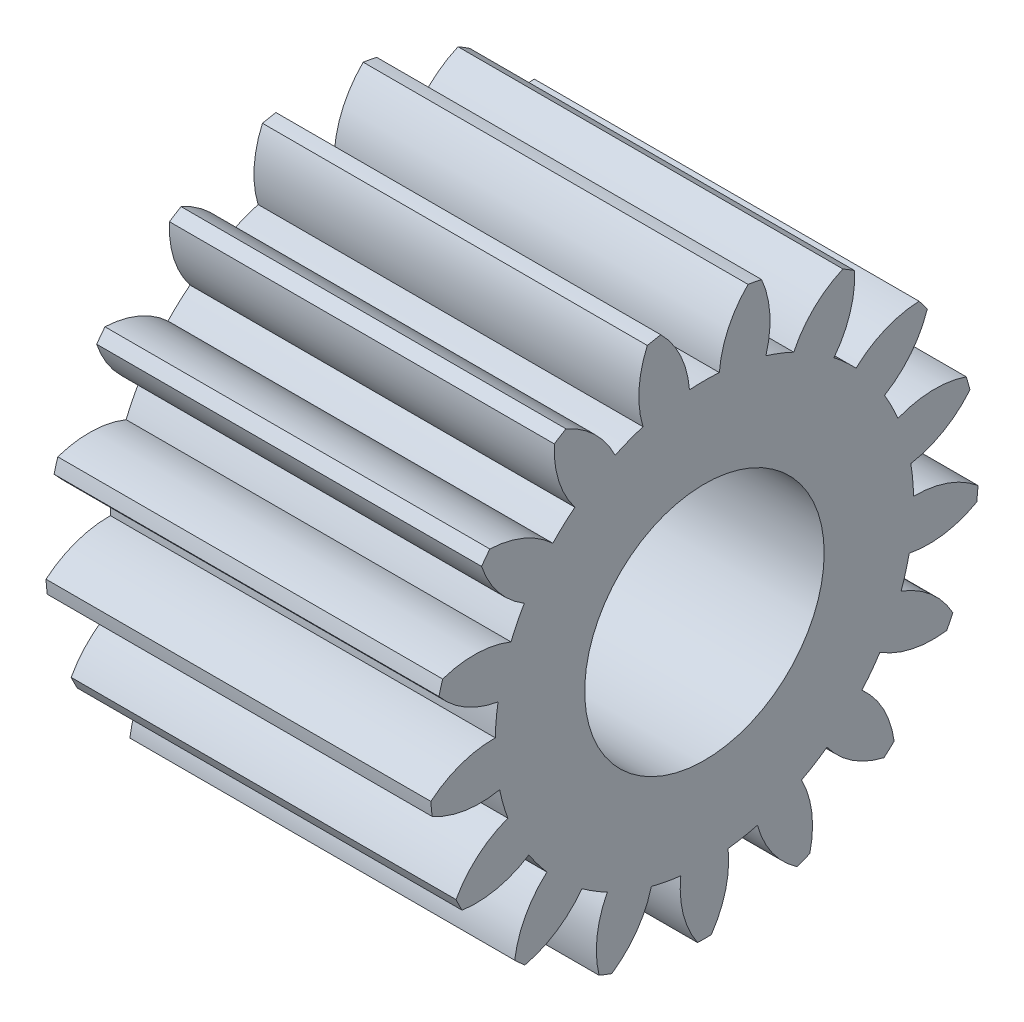
from build123d import *

# Parameters (mm, degrees)
SPUR_START             = -65.99548243
SPUR_GEAR_AM_OUTLINE_R = 2
SPUR_GEAR_AM_DEPTH     = 8.001
SKETCH1_R              = 2.4892
CUT_EXTRUDE1_DEPTH     = 38.916221237


# Read off the part's stored shape, not the designer's step: spur gear_am
with BuildPart() as part:
    # spur gear_am outline → spur gear_am (new body)
    with BuildSketch(Plane.YZ.offset(SPUR_START)):
        with BuildLine():
            ThreePointArc((15.314879055, 24.539540588), (15.391528072, 24.659938624), (15.465138567, 24.782218033))
            ThreePointArc((15.465138567, 24.782218033), (15.063480167, 25.38187856), (14.478147109, 25.804143203))
            ThreePointArc((14.478147109, 25.804143203), (14.600612124, 26.089561946), (14.70239475, 26.38299309))
            ThreePointArc((14.70239475, 26.38299309), (15.41943895, 26.300714095), (16.120256774, 26.473273058))
            ThreePointArc((16.120256774, 26.473273058), (16.148237066, 26.613229702), (16.172704392, 26.753843033))
            ThreePointArc((16.172704392, 26.753843033), (15.58154672, 27.167914071), (14.883200315, 27.350217435))
            ThreePointArc((14.883200315, 27.350217435), (14.894290398, 27.660601953), (14.883200315, 27.970986471))
            ThreePointArc((14.883200315, 27.970986471), (15.58154672, 28.153289835), (16.172704392, 28.567360874))
            ThreePointArc((16.172704392, 28.567360874), (16.148237066, 28.707974205), (16.120256774, 28.847930848))
            ThreePointArc((16.120256774, 28.847930848), (15.41943895, 29.020489811), (14.70239475, 28.938210816))
            ThreePointArc((14.70239475, 28.938210816), (14.600612124, 29.23164196), (14.478147109, 29.517060703))
            ThreePointArc((14.478147109, 29.517060703), (15.063480167, 29.939325346), (15.465138567, 30.538985873))
            ThreePointArc((15.465138567, 30.538985873), (15.391528072, 30.661265282), (15.314879055, 30.781663318))
            ThreePointArc((15.314879055, 30.781663318), (14.599050409, 30.68940516), (13.960149206, 30.35365604))
            ThreePointArc((13.960149206, 30.35365604), (13.759240179, 30.590504307), (13.541939811, 30.812409893))
            ThreePointArc((13.541939811, 30.812409893), (13.93520705, 31.417606636), (14.093119986, 32.121869174))
            ThreePointArc((14.093119986, 32.121869174), (13.980307826, 32.209300149), (13.865341959, 32.293879155))
            ThreePointArc((13.865341959, 32.293879155), (13.231179117, 31.949263852), (12.756708059, 31.405389388))
            ThreePointArc((12.756708059, 31.405389388), (12.483806507, 31.553667107), (12.201018405, 31.682089957))
            ThreePointArc((12.201018405, 31.682089957), (12.349106905, 32.388483625), (12.241947359, 33.102233616))
            ThreePointArc((12.241947359, 33.102233616), (12.105169441, 33.143008119), (11.967413502, 33.180345233))
            ThreePointArc((11.967413502, 33.180345233), (11.500563669, 32.629914991), (11.254602702, 31.951368441))
            ThreePointArc((11.254602702, 31.951368441), (10.946565493, 31.991049886), (10.636481757, 32.008645782))
            ThreePointArc((10.636481757, 32.008645782), (10.519391345, 32.720833997), (10.161631808, 33.347675549))
            ThreePointArc((10.161631808, 33.347675549), (10.019360749, 33.336286758), (9.87741944, 33.321339395))
            ThreePointArc((9.87741944, 33.321339395), (9.640933273, 32.639432869), (9.656700788, 31.917855705))
            ThreePointArc((9.656700788, 31.917855705), (9.355130054, 31.843581675), (9.059629211, 31.747974194))
            ThreePointArc((9.059629211, 31.747974194), (8.693173595, 32.369771991), (8.133131476, 32.82504668))
            ThreePointArc((8.133131476, 32.82504668), (8.00458177, 32.763032714), (7.877625051, 32.697819598))
            ThreePointArc((7.877625051, 32.697819598), (7.903441318, 31.976532042), (8.178807825, 31.309377259))
            ThreePointArc((8.178807825, 31.309377259), (7.924432364, 31.131178875), (7.68342344, 30.935280336))
            ThreePointArc((7.68342344, 30.935280336), (7.117094483, 31.382710477), (6.430406572, 31.604930933))
            ThreePointArc((6.430406572, 31.604930933), (6.33293957, 31.500667122), (6.23811365, 31.393995646))
            ThreePointArc((6.23811365, 31.393995646), (6.52274572, 30.730740941), (7.020521446, 30.208111489))
            ThreePointArc((7.020521446, 30.208111489), (6.847696075, 29.950055429), (6.69372866, 29.680323017))
            ThreePointArc((6.69372866, 29.680323017), (6.004012226, 29.892957582), (5.283419531, 29.852111701))
            ThreePointArc((5.283419531, 29.852111701), (5.23019869, 29.71967945), (5.180310335, 29.585956188))
            ThreePointArc((5.180310335, 29.585956188), (5.685317071, 29.070310558), (6.338274646, 28.76279044))
            ThreePointArc((6.338274646, 28.76279044), (6.270340387, 28.459728606), (6.224208635, 28.152591177))
            ThreePointArc((6.224208635, 28.152591177), (5.504254749, 28.10171269), (4.847077307, 27.803316934))
            ThreePointArc((4.847077307, 27.803316934), (4.845290398, 27.660601953), (4.847077307, 27.517886972))
            ThreePointArc((4.847077307, 27.517886972), (5.504254749, 27.219491216), (6.224208635, 27.168612729))
            ThreePointArc((6.224208635, 27.168612729), (6.270340387, 26.8614753), (6.338274646, 26.558413466))
            ThreePointArc((6.338274646, 26.558413466), (5.685317071, 26.250893348), (5.180310335, 25.735247718))
            ThreePointArc((5.180310335, 25.735247718), (5.23019869, 25.601524456), (5.283419531, 25.469092205))
            ThreePointArc((5.283419531, 25.469092205), (6.004012226, 25.428246324), (6.69372866, 25.640880889))
            ThreePointArc((6.69372866, 25.640880889), (6.847696075, 25.371148477), (7.020521446, 25.113092417))
            ThreePointArc((7.020521446, 25.113092417), (6.52274572, 24.590462965), (6.23811365, 23.927208261))
            ThreePointArc((6.23811365, 23.927208261), (6.33293957, 23.820536784), (6.430406572, 23.716272973))
            ThreePointArc((6.430406572, 23.716272973), (7.117094483, 23.938493429), (7.68342344, 24.38592357))
            ThreePointArc((7.68342344, 24.38592357), (7.924432364, 24.190025032), (8.178807825, 24.011826648))
            ThreePointArc((8.178807825, 24.011826648), (7.903441318, 23.344671864), (7.877625051, 22.623384308))
            ThreePointArc((7.877625051, 22.623384308), (8.00458177, 22.558171192), (8.133131476, 22.496157226))
            ThreePointArc((8.133131476, 22.496157226), (8.693173595, 22.951431915), (9.059629211, 23.573229712))
            ThreePointArc((9.059629211, 23.573229712), (9.355130054, 23.477622231), (9.656700788, 23.403348202))
            ThreePointArc((9.656700788, 23.403348202), (9.640933273, 22.681771038), (9.87741944, 21.999864511))
            ThreePointArc((9.87741944, 21.999864511), (10.019360749, 21.984917148), (10.161631808, 21.973528357))
            ThreePointArc((10.161631808, 21.973528357), (10.519391345, 22.600369909), (10.636481757, 23.312558124))
            ThreePointArc((10.636481757, 23.312558124), (10.946565493, 23.33015402), (11.254602702, 23.369835465))
            ThreePointArc((11.254602702, 23.369835465), (11.500563669, 22.691288915), (11.967413502, 22.140858673))
            ThreePointArc((11.967413502, 22.140858673), (12.105169441, 22.178195787), (12.241947359, 22.21897029))
            ThreePointArc((12.241947359, 22.21897029), (12.349106905, 22.932720281), (12.201018405, 23.639113949))
            ThreePointArc((12.201018405, 23.639113949), (12.483806507, 23.767536799), (12.756708059, 23.915814519))
            ThreePointArc((12.756708059, 23.915814519), (13.231179116, 23.371940054), (13.865341959, 23.027324751))
            ThreePointArc((13.865341959, 23.027324751), (13.980307825, 23.111903758), (14.093119986, 23.199334732))
            ThreePointArc((14.093119986, 23.199334732), (13.93520705, 23.90359727), (13.541939811, 24.508794013))
            ThreePointArc((13.541939811, 24.508794013), (13.759240179, 24.730699599), (13.960149206, 24.967547866))
            ThreePointArc((13.960149206, 24.967547866), (14.599050409, 24.631798746), (15.314879055, 24.539540588))
        make_face()
        with Locations((10.545290398, 27.660601953)):
            Circle(SPUR_GEAR_AM_OUTLINE_R, mode=Mode.SUBTRACT)
    extrude(amount=SPUR_GEAR_AM_DEPTH)

    # Sketch1 → Cut-Extrude1 (cut, through all)
    with BuildSketch(Plane(origin=(-57.99448243, 0, 0), x_dir=(0, 0, -1), z_dir=(1, 0, 0))):
        with Locations((-27.660601953, 10.545290398)):
            Circle(SKETCH1_R)
    extrude(amount=-CUT_EXTRUDE1_DEPTH, mode=Mode.SUBTRACT)


solid = part.part
